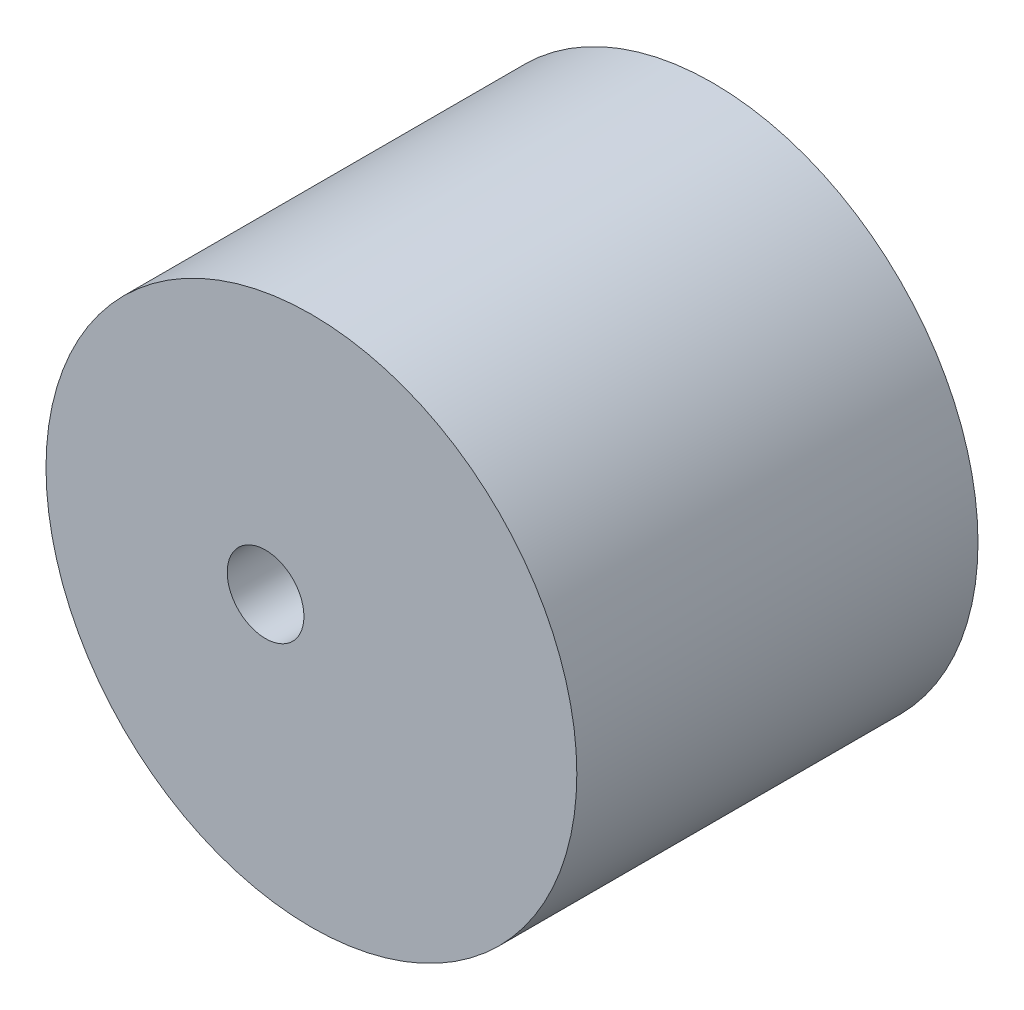
from build123d import *

# Parameters (mm, degrees)
SKETCH11_R           = 23.15625
SKETCH11_R_2         = 3.3475
BOSS_EXTRUDE13_DEPTH = 35


with BuildPart() as part:
    # Sketch11 → Boss-Extrude13 (new body)
    with BuildSketch(Plane.XY):
        Circle(SKETCH11_R)
        with Locations((-4, 0)):
            Circle(SKETCH11_R_2, mode=Mode.SUBTRACT)
    extrude(amount=BOSS_EXTRUDE13_DEPTH)


solid = part.part
